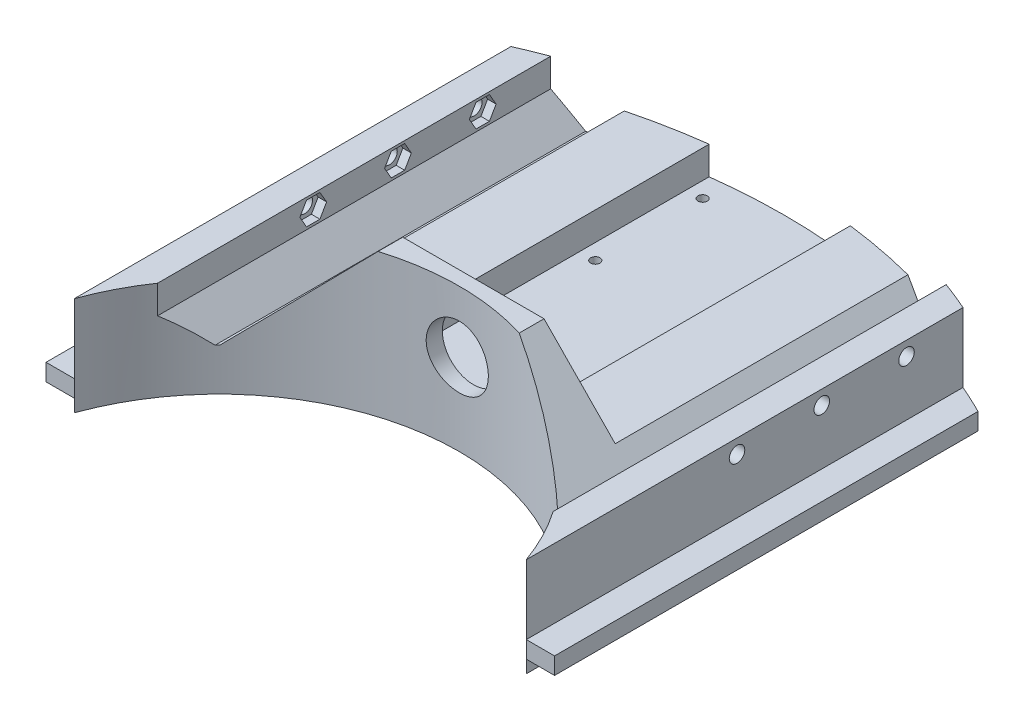
from build123d import *

# Parameters (mm, degrees)
SKETCH1_R                = 200
BOSS_EXTRUDE1_DEPTH      = 15
BOSS_EXTRUDE2_DEPTH      = 200
CUT_EXTRUDE1_DEPTH       = 286.087705803
CUT_EXTRUDE1_DEPTH_BACK  = 286.087705803
SKETCH3_R                = 85
CUT_EXTRUDE2_DEPTH       = 451.079120005
CUT_EXTRUDE2_DEPTH_BACK  = 451.079120005
SKETCH4_R                = 11
CUT_EXTRUDE3_DEPTH       = 451.079120105
CUT_EXTRUDE3_DEPTH_BACK  = 110
CUT_EXTRUDE4_DEPTH       = 110
BOSS_EXTRUDE3_DEPTH      = 200
CUT_EXTRUDE5_DEPTH       = 286.087705815
CUT_EXTRUDE5_DEPTH_BACK  = 286.087705815
SKETCH7_OUTSIDE_W        = 515.59
SKETCH7_OUTSIDE_H        = 515.59
SKETCH7_OUTSIDE_R        = 200
SKETCH9_R                = 4
BOSS_EXTRUDE4_DEPTH      = 220
CUT_EXTRUDE6_DEPTH       = 190
SKETCH11_R               = 3
CUT_EXTRUDE7_DEPTH       = 486.974499745
CUT_EXTRUDE8_DEPTH       = 302.61434707
CUT_EXTRUDE8_DEPTH_BACK  = 302.61434707
BOSS_EXTRUDE5_DEPTH      = 150
CUT_EXTRUDE9_DEPTH       = 262.287608345
CUT_EXTRUDE9_DEPTH_BACK  = 262.287608345
CUT_EXTRUDE10_DEPTH      = 259.795285906
CUT_EXTRUDE10_DEPTH_BACK = 259.795285906
SKETCH18_R               = 85
CUT_EXTRUDE11_START      = -15
CUT_EXTRUDE11_DEPTH      = 35
SKETCH20_R               = 2.75
CUT_EXTRUDE12_DEPTH      = 268.341007469
CUT_EXTRUDE13_DEPTH      = 3
CUT_EXTRUDE14_DEPTH      = 3
LPATTERN1_COUNT          = 3
LPATTERN1_PITCH          = 30
SKETCH23_R               = 1.65
CUT_EXTRUDE15_DEPTH      = 20
LPATTERN2_COUNT          = 3
LPATTERN2_PITCH          = 30
CUT_EXTRUDE16_DEPTH      = 3


# Read off the part's stored shape, not the designer's step: Cut-Extrude11
with BuildPart() as part:
    # Sketch1 → Boss-Extrude1 (new body)
    with BuildSketch(Plane(origin=(0, 0, 0), x_dir=(1, 0, 0), z_dir=(0, 1, 0))):
        with Locations(Location((0, 0, 0), (0, 0, 270))):
            Circle(SKETCH1_R)
    extrude(amount=BOSS_EXTRUDE1_DEPTH)

    # Sketch2 → Boss-Extrude2 (add, symmetric)
    with BuildSketch(Plane.XY):
        Polygon((-25, 50.707142143), (25, 50.707142143), (60, 15), (-60, 15), align=None)
    extrude(amount=BOSS_EXTRUDE2_DEPTH, both=True)

    # Sketch3 → Cut-Extrude1 (cut, two sides: drawn at the far end of the back side and taken through both)
    with BuildSketch(Plane(origin=(0, 15, 0), x_dir=(1, 0, 0), z_dir=(0, 1, 0)).offset(-CUT_EXTRUDE1_DEPTH_BACK)):
        with Locations(Location((0, 0, 0), (0, 0, 270))):
            Circle(SKETCH3_R)
    extrude(amount=CUT_EXTRUDE1_DEPTH + CUT_EXTRUDE1_DEPTH_BACK, mode=Mode.SUBTRACT)

    # Sketch4 → Cut-Extrude2 (cut, two sides: drawn at the far end of the back side and taken through both)
    with BuildSketch(Plane(origin=(0, 0, -200), x_dir=(-1, 0, 0), z_dir=(0, 0, -1)).offset(-CUT_EXTRUDE2_DEPTH_BACK)):
        with Locations((0, 29)):
            Circle(SKETCH4_R)
    extrude(amount=CUT_EXTRUDE2_DEPTH + CUT_EXTRUDE2_DEPTH_BACK, mode=Mode.SUBTRACT)

    # Sketch5 → Cut-Extrude3 (cut, two sides: drawn at the far end of the back side and taken through both)
    with BuildSketch(Plane.XY.offset(200).offset(-CUT_EXTRUDE3_DEPTH_BACK)):
        Polygon((-25, 50.707142143), (25, 50.707142143), (50.198039412, 25), (25, 25), (25, 15), (-25, 15), (-25, 25), (-50.198039412, 25), align=None)
    extrude(amount=CUT_EXTRUDE3_DEPTH + CUT_EXTRUDE3_DEPTH_BACK, mode=Mode.SUBTRACT)

    # Sketch6 → Cut-Extrude4 (cut)
    with BuildSketch(Plane(origin=(0, 0, -200), x_dir=(-1, 0, 0), z_dir=(0, 0, -1))):
        Polygon((-25, 50.707142143), (25, 50.707142143), (50.198039412, 25), (25, 25), (25, 15), (-25, 15), (-25, 25), (-50.198039412, 25), align=None)
    extrude(amount=-CUT_EXTRUDE4_DEPTH, mode=Mode.SUBTRACT)

    # Sketch8 → Boss-Extrude3 (add, symmetric)
    with BuildSketch(Plane(origin=(0, 0, 0), x_dir=(0, 0, -1), z_dir=(1, 0, 0))):
        Polygon((0, 15), (-20, 15), (-10, 35.712315177), (10, 35.712315177), (20, 15), align=None)
    extrude(amount=BOSS_EXTRUDE3_DEPTH, both=True)

    # Sketch7 outside → Cut-Extrude5 (cut, two sides: drawn at the far end of the back side and taken through both)
    with BuildSketch(Plane(origin=(0, 15, 0), x_dir=(1, 0, 0), z_dir=(0, 1, 0)).offset(-CUT_EXTRUDE5_DEPTH_BACK)):
        Rectangle(SKETCH7_OUTSIDE_W, SKETCH7_OUTSIDE_H)
        with Locations(Location((0, 0, 0), (0, 0, 97.180755781))):
            Circle(SKETCH7_OUTSIDE_R, mode=Mode.SUBTRACT)
    extrude(amount=CUT_EXTRUDE5_DEPTH + CUT_EXTRUDE5_DEPTH_BACK, mode=Mode.SUBTRACT)

    # Sketch9 → Boss-Extrude4 (add, symmetric)
    with BuildSketch(Plane(origin=(0, 0, 0), x_dir=(0, 0, -1), z_dir=(1, 0, 0))):
        with Locations(Location((0, 29, 0), (0, 0, 180))):
            Circle(SKETCH9_R)
    extrude(amount=BOSS_EXTRUDE4_DEPTH, both=True)

    # Sketch10 → Cut-Extrude6 (cut, symmetric)
    with BuildSketch(Plane(origin=(0, 0, 0), x_dir=(0, 0, -1), z_dir=(1, 0, 0))):
        Polygon((-20, 15), (20, 15), (10, 35.712315177), (-10, 35.712315177), align=None)
    extrude(amount=CUT_EXTRUDE6_DEPTH, both=True, mode=Mode.SUBTRACT)

    # Sketch11 → Cut-Extrude7 (cut, through all)
    with BuildSketch(Plane.ZY.offset(220)):
        with Locations((0, 29)):
            Circle(SKETCH11_R)
    extrude(amount=-CUT_EXTRUDE7_DEPTH, mode=Mode.SUBTRACT)

    # Sketch14 → Cut-Extrude8 (cut, two sides: drawn at the far end of the back side and taken through both)
    with BuildSketch(Plane(origin=(0, 0, 0), x_dir=(1, 0, 0), z_dir=(0, 1, 0)).offset(-CUT_EXTRUDE8_DEPTH_BACK)):
        Polygon((-80, 28.722813233), (-80, 204.683452683), (-270.013244013, 28.722813233), (-103.583737584, -216.10995611), (187.046893047, -216.10995611), (266.535612536, 150.034958035), (80, 209.154693155), (80, 28.722813233), align=None)
    extrude(amount=CUT_EXTRUDE8_DEPTH + CUT_EXTRUDE8_DEPTH_BACK, mode=Mode.SUBTRACT)

    # Sketch16 → Boss-Extrude5 (add, symmetric)
    with BuildSketch(Plane(origin=(0, 0, -90), x_dir=(-1, 0, 0), z_dir=(0, 0, -1))):
        Polygon((-80, 15), (-80, 35), (-70, 35), (-70, 25), (-60.807611845, 15), (-60.807611845, 0), (-80, 0), (-80, 4.5), (-90, 4.5), (-90, 10.5), (-80, 10.5), align=None)
        Polygon((80, 15), (80, 35), (70, 35), (70, 25), (60.807611845, 15), (60.807611845, 0), (80, 0), (80, 4.5), (90, 4.5), (90, 10.5), (80, 10.5), align=None)
    extrude(amount=BOSS_EXTRUDE5_DEPTH, both=True)

    # Sketch17 → Cut-Extrude9 (cut, two sides: drawn at the far end of the back side and taken through both)
    with BuildSketch(Plane(origin=(0, 0, 0), x_dir=(1, 0, 0), z_dir=(0, 1, 0)).offset(-CUT_EXTRUDE9_DEPTH_BACK)):
        Polygon((-80, 28.722813233), (-99.608008808, 28.722813233), (-99.608008808, -74.271563426), (112.245925984, -74.271563426), (112.245925984, 0), (109.222119936, 28.722813233), (80, 28.722813233), align=None)
    extrude(amount=CUT_EXTRUDE9_DEPTH + CUT_EXTRUDE9_DEPTH_BACK, mode=Mode.SUBTRACT)

    # Sketch18 → Cut-Extrude10 (cut, two sides: drawn at the far end of the back side and taken through both)
    with BuildSketch(Plane(origin=(0, 15, 0), x_dir=(1, 0, 0), z_dir=(0, 1, 0)).offset(-CUT_EXTRUDE10_DEPTH_BACK)):
        Circle(SKETCH18_R)
    extrude(amount=CUT_EXTRUDE10_DEPTH + CUT_EXTRUDE10_DEPTH_BACK, mode=Mode.SUBTRACT)

    # Cut-Extrude11 outline → Cut-Extrude11 (cut)
    with BuildSketch(Plane(origin=(0, 15, 0), x_dir=(1, 0, 0), z_dir=(0, 1, 0)).offset(CUT_EXTRUDE11_START)):
        with BuildLine():
            Line((60.807611845, 240), (60.807611845, 190.531977216))
            ThreePointArc((60.807611845, 190.531977216), (75.639228606, 185.145097413), (90, 178.605710995))
            Line((90, 178.605710995), (90, 240))
            Line((90, 240), (60.807611845, 240))
        make_face()
        with BuildLine():
            Line((-60.807611845, 190.531977216), (-60.807611845, 240))
            Line((-60.807611845, 240), (-90, 240))
            Line((-90, 240), (-90, 178.605710995))
            ThreePointArc((-90, 178.605710995), (-75.639228606, 185.145097413), (-60.807611845, 190.531977216))
        make_face()
    extrude(amount=CUT_EXTRUDE11_DEPTH, mode=Mode.SUBTRACT)

    # Sketch20 → Cut-Extrude12 (cut, through all)
    with BuildSketch(Plane.ZY.offset(80)):
        with Locations((-163.303027798, 30)):
            Circle(SKETCH20_R)
        with Locations((-103.303027798, 30)):
            Circle(SKETCH20_R)
        with Locations((-133.303027798, 30)):
            Circle(SKETCH20_R)
    extrude(amount=-CUT_EXTRUDE12_DEPTH, mode=Mode.SUBTRACT)

    # Sketch21 → Cut-Extrude13 (cut)
    with BuildSketch(Plane(origin=(-70, 0, 0), x_dir=(0, 0, -1), z_dir=(1, 0, 0))):
        Polygon((100.935891695, 34.1), (98.568755591, 30), (100.935891695, 25.9), (105.670163902, 25.9), (108.037300006, 30), (105.670163902, 34.1), (103.303027798, 34.1), align=None)
    cut_extrude13 = extrude(amount=-CUT_EXTRUDE13_DEPTH, mode=Mode.SUBTRACT)

    # Sketch22 → Cut-Extrude14 (cut)
    with BuildSketch(Plane.ZY.offset(-70)):
        Polygon((-163.303027798, 34.1), (-160.933027798, 34.1), (-158.565891695, 30), (-160.933027798, 25.9), (-163.303027798, 25.9), (-165.673027798, 25.9), (-168.040163902, 30), (-165.673027798, 34.1), align=None)
    cut_extrude14 = extrude(amount=-CUT_EXTRUDE14_DEPTH, mode=Mode.SUBTRACT)

    # LPattern1: Cut-Extrude14 ×3
    with Locations(*[(0, 0, i * LPATTERN1_PITCH) for i in range(1, LPATTERN1_COUNT)]):
        add(cut_extrude14, mode=Mode.SUBTRACT)

    # Sketch23 → Cut-Extrude15 (cut)
    with BuildSketch(Plane(origin=(0, 15, 0), x_dir=(1, 0, 0), z_dir=(0, 1, 0))):
        with Locations(Location((19.5, 152.65, 0), (0, 0, 270))):
            Circle(SKETCH23_R)
        with Locations(Location((-19.5, 152.65, 0), (0, 0, 270))):
            Circle(SKETCH23_R)
        with Locations(Location((-19.5, 190.65, 0), (0, 0, 270))):
            Circle(SKETCH23_R)
        with Locations(Location((19.5, 190.65, 0), (0, 0, 270))):
            Circle(SKETCH23_R)
    extrude(amount=-CUT_EXTRUDE15_DEPTH, mode=Mode.SUBTRACT)

    # LPattern2: Cut-Extrude13 ×3
    with Locations(*[(0, 0, -i * LPATTERN2_PITCH) for i in range(1, LPATTERN2_COUNT)]):
        add(cut_extrude13, mode=Mode.SUBTRACT)

    # Sketch24 → Cut-Extrude16 (cut)
    with BuildSketch(Plane.XZ):
        Polygon((-19.5, -187.8), (-17.854551733, -187.8), (-16.209103466, -190.65), (-17.854551733, -193.5), (-21.145448267, -193.5), (-22.790896534, -190.65), (-21.145448267, -187.8), align=None)
        Polygon((-19.5, -149.8), (-17.854551733, -149.8), (-16.209103466, -152.65), (-17.854551733, -155.5), (-21.145448267, -155.5), (-22.790896534, -152.65), (-21.145448267, -149.8), align=None)
        Polygon((19.5, -149.8), (21.145448267, -149.8), (22.790896534, -152.65), (21.145448267, -155.5), (17.854551733, -155.5), (16.209103466, -152.65), (17.854551733, -149.8), align=None)
        Polygon((19.5, -187.8), (21.145448267, -187.8), (22.790896713, -190.649999897), (21.145448624, -193.5), (17.85455209, -193.5), (16.209103644, -190.650000103), (17.854551733, -187.8), align=None)
    extrude(amount=-CUT_EXTRUDE16_DEPTH, mode=Mode.SUBTRACT)


solid = part.part
